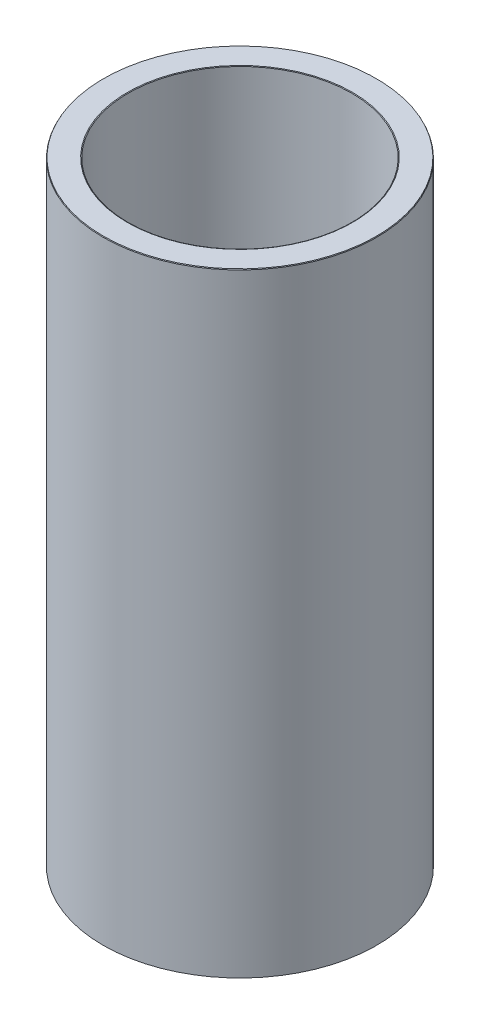
from build123d import *
from OCP.BRepFilletAPI import BRepFilletAPI_MakeChamfer

# Parameters (mm, degrees)
SKETCH1_R           = 52.5
BOSS_EXTRUDE1_DEPTH = 235.676727146
SKETCH2_R           = 42.929426356
CUT_EXTRUDE1_DEPTH  = 248.095163283
CHAMFER1_SIZE       = 0.291604482
CHAMFER1_SIZE2      = 0.146641538


with BuildPart() as part:
    # Sketch1 → Boss-Extrude1 (new body)
    with BuildSketch(Plane(origin=(0, 0, 0), x_dir=(1, 0, 0), z_dir=(0, 1, 0))):
        Circle(SKETCH1_R)
    extrude(amount=BOSS_EXTRUDE1_DEPTH)

    # Sketch2 → Cut-Extrude1 (cut, through all)
    with BuildSketch(Plane(origin=(0, 0, 0), x_dir=(1, 0, 0), z_dir=(0, 1, 0))):
        Circle(SKETCH2_R)
    extrude(amount=CUT_EXTRUDE1_DEPTH, mode=Mode.SUBTRACT)

    # Chamfer1: one chamfer whose edges measure the first distance from different faces: ONE call of the kernel's chamfer builder (chamfer() names one face for all edges)
    chamfer1_edges_1 = [part.edges().sort_by_distance(p)[0] for p in [
        (-42.929426356, 235.676727146, 0),
    ]]
    chamfer1_side_1 = [part.faces().sort_by_distance(p)[0] for p in [
        (-51.01507576, 235.676727146, 0),
    ]]
    chamfer1_edges_2 = [part.edges().sort_by_distance(p)[0] for p in [
        (-42.929426356, 0, 0),
    ]]
    chamfer1_side_2 = [part.faces().sort_by_distance(p)[0] for p in [
        (-42.929426356, 117.838363573, 0),
    ]]
    chamfer1_edges_3 = [part.edges().sort_by_distance(p)[0] for p in [
        (-52.5, 0, 0),
    ]]
    chamfer1_side_3 = [part.faces().sort_by_distance(p)[0] for p in [
        (-51.01507576, 0, 0),
    ]]
    chamfer1_edges_4 = [part.edges().sort_by_distance(p)[0] for p in [
        (-52.5, 235.676727146, 0),
    ]]
    chamfer1_side_4 = [part.faces().sort_by_distance(p)[0] for p in [
        (-52.5, 117.838363573, 0),
    ]]
    chamfer1 = BRepFilletAPI_MakeChamfer(part.part.solid().wrapped)
    for e in chamfer1_edges_1:
        chamfer1.Add(CHAMFER1_SIZE, CHAMFER1_SIZE2, e.wrapped, chamfer1_side_1[0].wrapped)  # the first distance lies on this face
    for e in chamfer1_edges_2:
        chamfer1.Add(CHAMFER1_SIZE, CHAMFER1_SIZE2, e.wrapped, chamfer1_side_2[0].wrapped)  # the first distance lies on this face
    for e in chamfer1_edges_3:
        chamfer1.Add(CHAMFER1_SIZE, CHAMFER1_SIZE2, e.wrapped, chamfer1_side_3[0].wrapped)  # the first distance lies on this face
    for e in chamfer1_edges_4:
        chamfer1.Add(CHAMFER1_SIZE, CHAMFER1_SIZE2, e.wrapped, chamfer1_side_4[0].wrapped)  # the first distance lies on this face
    add(Compound.cast(chamfer1.Shape()), mode=Mode.REPLACE)


solid = part.part
